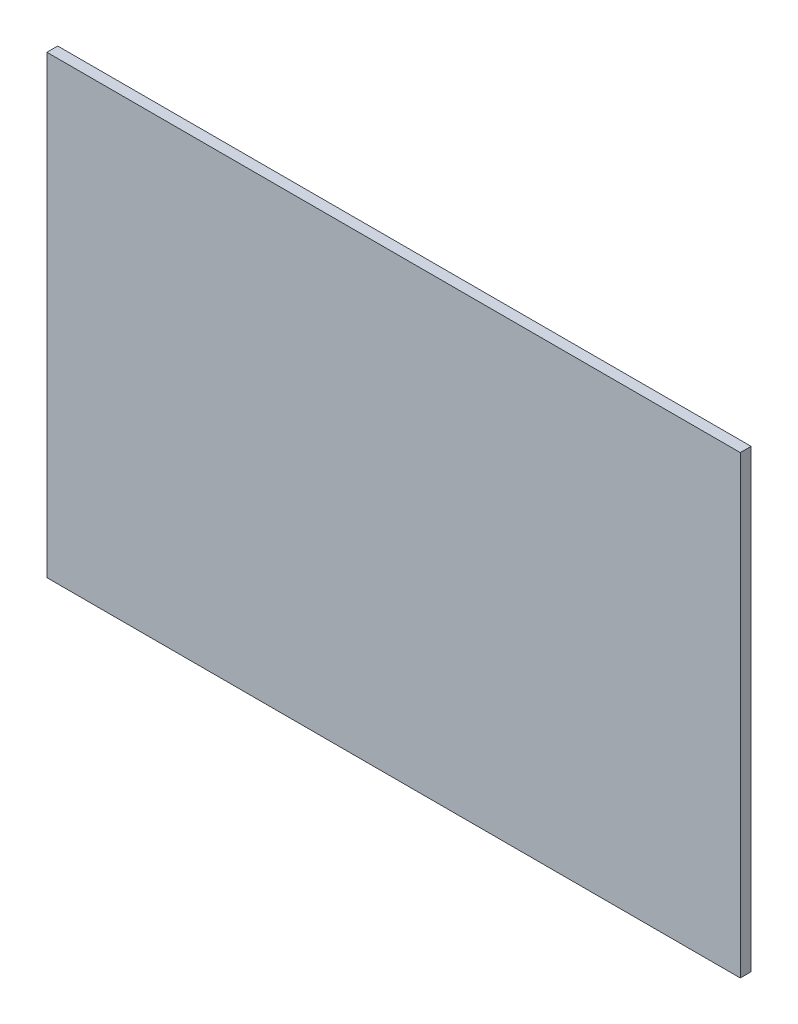
from build123d import *

# Parameters (mm, degrees)
SKETCH1_W          = 320
SKETCH1_H          = 210
BASE_FLANGE1_DEPTH = 5


# Sheet-metal steps are written as plain solids
with BuildPart() as part:
    # Sketch1 → Base-Flange1 (new body)
    with BuildSketch(Plane.XY):
        Rectangle(SKETCH1_W, SKETCH1_H)
    extrude(amount=-BASE_FLANGE1_DEPTH)


solid = part.part
